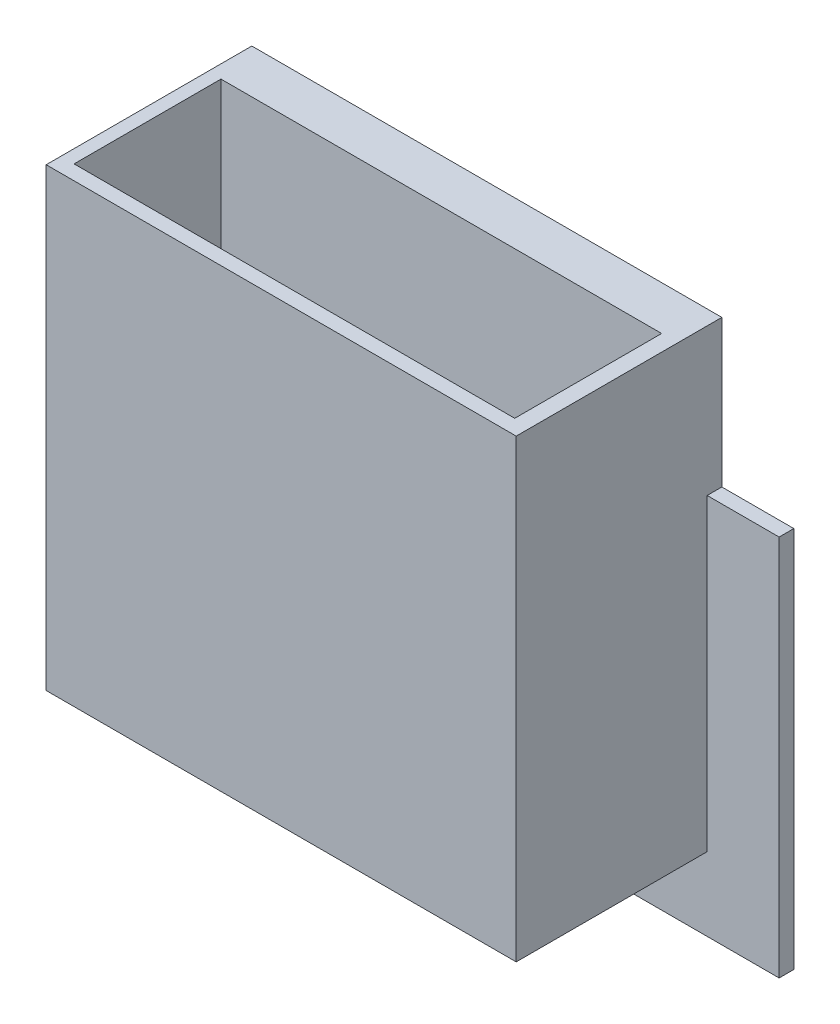
from build123d import *

# Parameters (mm, degrees)
BOSS_EXTRUDE1_DEPTH = 1
BOSS_EXTRUDE2_DEPTH = 14
SKETCH1_4_W         = 30
SKETCH1_4_H         = 10
BOSS_EXTRUDE3_DEPTH = 3
SKETCH2_W           = 30
SKETCH2_H           = 1
BOSS_EXTRUDE4_DEPTH = 30


with BuildPart() as part:
    # Sketch1 → Boss-Extrude1 (new body)
    with BuildSketch(Plane.XY):
        Polygon((0, 26), (0, 0), (42, 0), (42, 26), (37.1, 26), (37.1, 4.998417192), (5.1, 4.998417192), (5.1, 26), align=None)
    extrude(amount=BOSS_EXTRUDE1_DEPTH)

    # Sketch1<3> → Boss-Extrude2 (add)
    with BuildSketch(Plane.XY):
        Polygon((5.1, 36), (5.1, 4.998417192), (37.1, 4.998417192), (37.1, 36), (36, 36), (36, 6), (6, 6), (6, 36), align=None)
    extrude(amount=BOSS_EXTRUDE2_DEPTH)

    # Sketch1<4> → Boss-Extrude3 (add)
    with BuildSketch(Plane.XY):
        with Locations((21, 31)):
            Rectangle(SKETCH1_4_W, SKETCH1_4_H)
    extrude(amount=BOSS_EXTRUDE3_DEPTH)

    # Sketch2 → Boss-Extrude4 (add)
    with BuildSketch(Plane(origin=(0, 6, 0), x_dir=(1, 0, 0), z_dir=(0, 1, 0))):
        with Locations((21, -13.5)):
            Rectangle(SKETCH2_W, SKETCH2_H)
    extrude(amount=BOSS_EXTRUDE4_DEPTH)


solid = part.part
